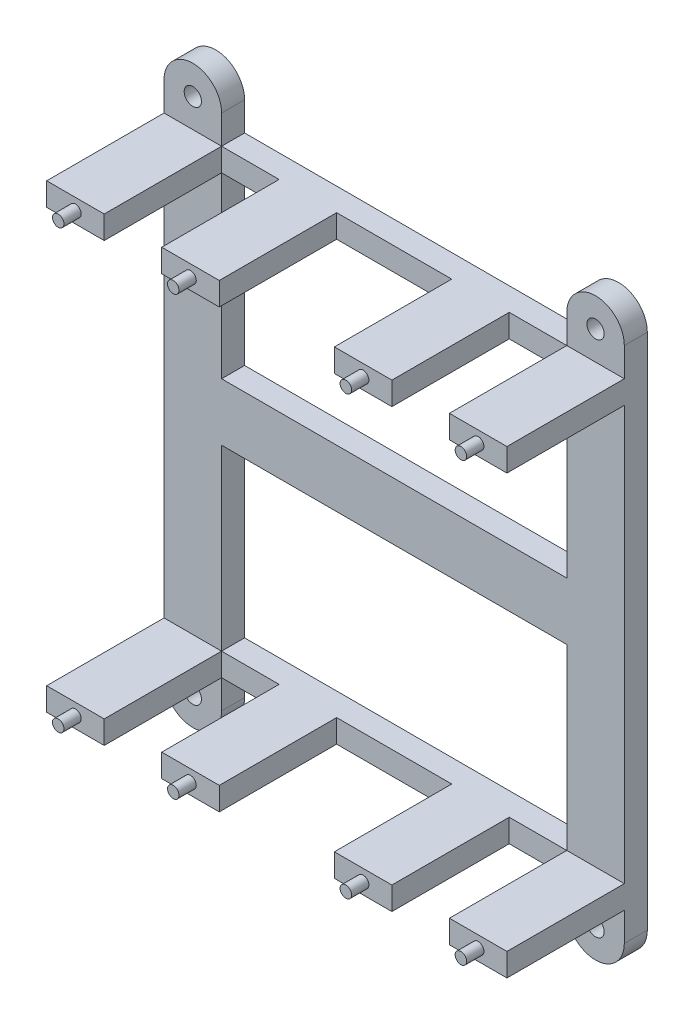
from build123d import *
from build123d.topology import SkipClean

# Parameters (mm, degrees)
CROQUIS1_W                  = 10
CROQUIS1_H                  = 10
CROQUIS1_R                  = 1.5
CROQUIS1_H_2                = 4
CROQUIS1_R_2                = 3
CROQUIS1_R_3                = 1.25
CROQUIS1_R_4                = 3.5
CROQUIS1_R_5                = 2.2
SALIENTE_EXTRUIR5_DEPTH     = 4
SALIENTE_EXTRUIR6_START     = 4
CROQUIS1_6_W                = 10
CROQUIS1_6_H                = 4
SALIENTE_EXTRUIR6_DEPTH     = 20.4
SALIENTE_EXTRUIR7_START     = 24.4
CROQUIS1_7_W                = 10
CROQUIS1_7_H                = 4
CROQUIS1_7_R                = 3
CROQUIS1_7_R_2              = 3.5
CROQUIS1_7_R_3              = 2.2
CROQUIS1_7_R_4              = 1.5
CROQUIS1_7_R_5              = 1.25
CROQUIS1_7_H_2              = 31
CROQUIS1_7_H_3              = 10
SALIENTE_EXTRUIR7_DEPTH     = 4
SALIENTE_EXTRUIR9_START     = 28.4
SALIENTE_EXTRUIR9_OUTLINE_R = 3
SALIENTE_EXTRUIR9_DEPTH     = 4
SALIENTE_EXTRUIR10_START    = 28.4
CROQUIS1_11_R               = 3.5
SALIENTE_EXTRUIR10_DEPTH    = 14
CORTAR_EXTRUIR1_DEPTH       = 14
CORTAR_EXTRUIR1_DEPTH_BACK  = 14
CORTAR_EXTRUIR1_START       = 28.4
CROQUIS1_12_R               = 1.5
CROQUIS1_12_R_2             = 1.25
CORTAR_EXTRUIR2_START       = 24.4
CROQUIS1_13_R               = 2.2
CORTAR_EXTRUIR2_DEPTH       = 15
REDONDEO2_RADIUS            = 5
REDONDEO2_LENGTH            = 4
REDONDEO3_RADIUS            = 5
REDONDEO3_LENGTH            = 4
REDONDEO4_RADIUS            = 5
REDONDEO4_LENGTH            = 4
REDONDEO5_RADIUS            = 5
REDONDEO5_LENGTH            = 4
REDONDEO6_R                 = 4
REDONDEO7_R                 = 4
CORTAR_EXTRUIR6_START       = 28.4
CROQUIS2_RX                 = 30
CROQUIS2_RY                 = 25
CROQUIS2_RX_2               = 36
CROQUIS2_RY_2               = 20
CORTAR_EXTRUIR6_DEPTH       = 8
CROQUIS3_W                  = 80
CROQUIS3_H                  = 18
CORTAR_EXTRUIR7_DEPTH       = 80
CROQUIS4_R                  = 1
SALIENTE_EXTRUIR11_DEPTH    = 3


# Read off the part's stored shape, not the designer's step: Saliente-Extruir9
with BuildPart() as part:
    # Croquis1 → Saliente-Extruir5 (new body)
    # profile 1 of 42: a face of its own
    with SkipClean():  # the faces are left unmerged after this step: merging them gives an invalid solid
        with BuildSketch(Plane.XY):
            with Locations((-45.946521078, 63.070175439)):
                Rectangle(CROQUIS1_W, CROQUIS1_H)
            with Locations((-45.946521078, 63.070175439)):
                Circle(CROQUIS1_R, mode=Mode.SUBTRACT)
        # profile 2 of 42: a face of its own
        with BuildSketch(Plane.XY):
            with Locations((24.053478922, 63.070175439)):
                Rectangle(CROQUIS1_W, CROQUIS1_H)
            with Locations((24.053478922, 63.070175439)):
                Circle(CROQUIS1_R, mode=Mode.SUBTRACT)
        # profile 3 of 42: a face of its own
        with BuildSketch(Plane.XY):
            with Locations((24.053478922, -26.929824561)):
                Rectangle(CROQUIS1_W, CROQUIS1_H)
            with Locations((24.053478922, -26.929824561)):
                Circle(CROQUIS1_R, mode=Mode.SUBTRACT)
        # profile 4 of 42: a face of its own
        with BuildSketch(Plane.XY):
            with Locations((-45.946521078, -26.929824561)):
                Rectangle(CROQUIS1_W, CROQUIS1_H)
            with Locations((-45.946521078, -26.929824561)):
                Circle(CROQUIS1_R, mode=Mode.SUBTRACT)
        # profile 5 of 42: a face of its own
        with BuildSketch(Plane.XY):
            with Locations((-45.946521078, -19.929824561)):
                Rectangle(CROQUIS1_W, CROQUIS1_H_2)
        # profile 6 of 42: a face of its own
        with BuildSketch(Plane.XY):
            with Locations((-35.946521078, -19.929824561)):
                Rectangle(CROQUIS1_W, CROQUIS1_H_2)
        # profile 7 of 42: a face of its own
        with BuildSketch(Plane.XY):
            with Locations((-25.946521078, -19.929824561)):
                Rectangle(CROQUIS1_W, CROQUIS1_H_2)
        # profile 8 of 42: a face of its own
        with BuildSketch(Plane.XY):
            with Locations((-15.946521078, -19.929824561)):
                Rectangle(CROQUIS1_W, CROQUIS1_H_2)
        # profile 9 of 42: a face of its own
        with BuildSketch(Plane.XY):
            with Locations((-5.946521078, -19.929824561)):
                Rectangle(CROQUIS1_W, CROQUIS1_H_2)
        # profile 10 of 42: a face of its own
        with BuildSketch(Plane.XY):
            with Locations((4.053478922, -19.929824561)):
                Rectangle(CROQUIS1_W, CROQUIS1_H_2)
        # profile 11 of 42: a face of its own
        with BuildSketch(Plane.XY):
            with Locations((14.053478922, -19.929824561)):
                Rectangle(CROQUIS1_W, CROQUIS1_H_2)
        # profile 12 of 42: a face of its own
        with BuildSketch(Plane.XY):
            with Locations((24.053478922, -19.929824561)):
                Rectangle(CROQUIS1_W, CROQUIS1_H_2)
        # profile 13 of 42: a face of its own
        with BuildSketch(Plane.XY):
            Polygon((29.053478922, 13.070175439), (19.053478922, 13.070175439), (19.053478922, -17.929824561), (29.053478922, -17.929824561), (29.053478922, -6.429824561), align=None)
            with Locations((26.053478922, -6.429824561)):
                Circle(CROQUIS1_R_2, mode=Mode.SUBTRACT)
        # profile 14 of 42: a face of its own
        with BuildSketch(Plane.XY):
            with Locations((26.053478922, -6.429824561)):
                Circle(CROQUIS1_R_2)
            with Locations((26.053478922, -6.429824561)):
                Circle(CROQUIS1_R_3, mode=Mode.SUBTRACT)
        # profile 15 of 42: a face of its own
        with BuildSketch(Plane.XY):
            with Locations((26.053478922, -6.429824561)):
                Circle(CROQUIS1_R_3)
        # profile 16 of 42: a face of its own
        with BuildSketch(Plane.XY):
            Polygon((-40.946521078, -17.929824561), (-40.946521078, 13.070175439), (-50.946521078, 13.070175439), (-50.946521078, -6.929824541), (-50.946521078, -17.929824561), align=None)
            with BuildLine():
                ThreePointArc((-43.946521078, -6.929824561), (-47.446521088, -10.429824561), (-50.946521078, -6.929824541))
                ThreePointArc((-50.946521078, -6.929824541), (-47.446521067, -3.429824561), (-43.946521078, -6.929824561))
            make_face(mode=Mode.SUBTRACT)
        # profile 17 of 42: a face of its own
        with BuildSketch(Plane.XY):
            with Locations((-47.446521078, -6.929824561)):
                Circle(CROQUIS1_R_4)
            with Locations((-47.446521078, -6.929824561)):
                Circle(CROQUIS1_R_5, mode=Mode.SUBTRACT)
        # profile 18 of 42: a face of its own
        with BuildSketch(Plane.XY):
            with Locations((-47.446521078, -6.929824561)):
                Circle(CROQUIS1_R_5)
            with Locations((-47.446521078, -6.929824561)):
                Circle(CROQUIS1_R, mode=Mode.SUBTRACT)
        # profile 19 of 42: a face of its own
        with BuildSketch(Plane.XY):
            with Locations((-47.446521078, -6.929824561)):
                Circle(CROQUIS1_R)
        # profile 20 of 42: a face of its own
        with BuildSketch(Plane.XY):
            with Locations((-45.946521078, 18.070175439)):
                Rectangle(CROQUIS1_W, CROQUIS1_H)
        # profile 21 of 42: a face of its own
        with BuildSketch(Plane.XY):
            with Locations((-35.946521078, 18.070175439)):
                Rectangle(CROQUIS1_W, CROQUIS1_H)
        # profile 22 of 42: a face of its own
        with BuildSketch(Plane.XY):
            with Locations((-25.946521078, 18.070175439)):
                Rectangle(CROQUIS1_W, CROQUIS1_H)
        # profile 23 of 42: a face of its own
        with BuildSketch(Plane.XY):
            with Locations((-15.946521078, 18.070175439)):
                Rectangle(CROQUIS1_W, CROQUIS1_H)
        # profile 24 of 42: a face of its own
        with BuildSketch(Plane.XY):
            with Locations((-5.946521078, 18.070175439)):
                Rectangle(CROQUIS1_W, CROQUIS1_H)
        # profile 25 of 42: a face of its own
        with BuildSketch(Plane.XY):
            with Locations((4.053478922, 18.070175439)):
                Rectangle(CROQUIS1_W, CROQUIS1_H)
        # profile 26 of 42: a face of its own
        with BuildSketch(Plane.XY):
            with Locations((14.053478922, 18.070175439)):
                Rectangle(CROQUIS1_W, CROQUIS1_H)
        # profile 27 of 42: a face of its own
        with BuildSketch(Plane.XY):
            with Locations((24.053478922, 18.070175439)):
                Rectangle(CROQUIS1_W, CROQUIS1_H)
        # profile 28 of 42: a face of its own
        with BuildSketch(Plane.XY):
            Polygon((-40.946521078, 54.070175439), (-50.946521078, 54.070175439), (-50.946521078, 43.070175439), (-50.946521078, 23.070175439), (-40.946521078, 23.070175439), align=None)
            with BuildLine():
                ThreePointArc((-43.946521078, 43.070175439), (-47.446521078, 39.570175439), (-50.946521078, 43.070175439))
                ThreePointArc((-50.946521078, 43.070175439), (-47.446521078, 46.570175439), (-43.946521078, 43.070175439))
            make_face(mode=Mode.SUBTRACT)
        # profile 29 of 42: a face of its own
        with BuildSketch(Plane.XY):
            with Locations((-45.946521078, 56.070175439)):
                Rectangle(CROQUIS1_W, CROQUIS1_H_2)
        # profile 30 of 42: a face of its own
        with BuildSketch(Plane.XY):
            with Locations((-47.446521078, 43.070175439)):
                Circle(CROQUIS1_R_4)
            with Locations((-47.446521078, 43.070175439)):
                Circle(CROQUIS1_R_5, mode=Mode.SUBTRACT)
        # profile 31 of 42: a face of its own
        with BuildSketch(Plane.XY):
            with Locations((-47.446521078, 43.070175439)):
                Circle(CROQUIS1_R_5)
            with Locations((-47.446521078, 43.070175439)):
                Circle(CROQUIS1_R, mode=Mode.SUBTRACT)
        # profile 32 of 42: a face of its own
        with BuildSketch(Plane.XY):
            with Locations((-47.446521078, 43.070175439)):
                Circle(CROQUIS1_R)
        # profile 33 of 42: a face of its own
        with BuildSketch(Plane.XY):
            with Locations((-35.946521078, 56.070175439)):
                Rectangle(CROQUIS1_W, CROQUIS1_H_2)
        # profile 34 of 42: a face of its own
        with BuildSketch(Plane.XY):
            with Locations((-25.946521078, 56.070175439)):
                Rectangle(CROQUIS1_W, CROQUIS1_H_2)
        # profile 35 of 42: a face of its own
        with BuildSketch(Plane.XY):
            with Locations((-15.946521078, 56.070175439)):
                Rectangle(CROQUIS1_W, CROQUIS1_H_2)
        # profile 36 of 42: a face of its own
        with BuildSketch(Plane.XY):
            with Locations((-5.946521078, 56.070175439)):
                Rectangle(CROQUIS1_W, CROQUIS1_H_2)
        # profile 37 of 42: a face of its own
        with BuildSketch(Plane.XY):
            with Locations((4.053478922, 56.070175439)):
                Rectangle(CROQUIS1_W, CROQUIS1_H_2)
        # profile 38 of 42: a face of its own
        with BuildSketch(Plane.XY):
            with Locations((14.053478922, 56.070175439)):
                Rectangle(CROQUIS1_W, CROQUIS1_H_2)
        # profile 39 of 42: a face of its own
        with BuildSketch(Plane.XY):
            with Locations((24.053478922, 56.070175439)):
                Rectangle(CROQUIS1_W, CROQUIS1_H_2)
        # profile 40 of 42: a face of its own
        with BuildSketch(Plane.XY):
            Polygon((29.053478922, 54.070175439), (19.053478922, 54.070175439), (19.053478922, 23.070175439), (29.053478922, 23.070175439), (29.053478922, 42.570175439), align=None)
            with Locations((26.053478922, 42.570175439)):
                Circle(CROQUIS1_R_2, mode=Mode.SUBTRACT)
        # profile 41 of 42: a face of its own
        with BuildSketch(Plane.XY):
            with Locations((26.053478922, 42.570175439)):
                Circle(CROQUIS1_R_2)
            with Locations((26.053478922, 42.570175439)):
                Circle(CROQUIS1_R_3, mode=Mode.SUBTRACT)
        # profile 42 of 42: a face of its own
        with BuildSketch(Plane.XY):
            with Locations((26.053478922, 42.570175439)):
                Circle(CROQUIS1_R_3)
        extrude(amount=SALIENTE_EXTRUIR5_DEPTH)

    # Croquis1<6> → Saliente-Extruir6 (add)
    with BuildSketch(Plane.XY.offset(SALIENTE_EXTRUIR6_START)):
        with Locations((-45.946521078, 56.070175439)):
            Rectangle(CROQUIS1_6_W, CROQUIS1_6_H)
        with Locations((-25.946521078, 56.070175439)):
            Rectangle(CROQUIS1_6_W, CROQUIS1_6_H)
        with Locations((24.053478922, 56.070175439)):
            Rectangle(CROQUIS1_6_W, CROQUIS1_6_H)
        with Locations((4.053478922, 56.070175439)):
            Rectangle(CROQUIS1_6_W, CROQUIS1_6_H)
        with Locations((-45.946521078, -19.929824561)):
            Rectangle(CROQUIS1_6_W, CROQUIS1_6_H)
        with Locations((-25.946521078, -19.929824561)):
            Rectangle(CROQUIS1_6_W, CROQUIS1_6_H)
        with Locations((4.053478922, -19.929824561)):
            Rectangle(CROQUIS1_6_W, CROQUIS1_6_H)
        with Locations((24.053478922, -19.929824561)):
            Rectangle(CROQUIS1_6_W, CROQUIS1_6_H)
    extrude(amount=SALIENTE_EXTRUIR6_DEPTH)

    # Croquis1<7> → Saliente-Extruir7 (add)
    # profile 1 of 90: a face of its own
    with SkipClean():  # the faces are left unmerged after this step: merging them gives an invalid solid
        with BuildSketch(Plane.XY.offset(SALIENTE_EXTRUIR7_START)):
            with Locations((-45.946521078, 56.070175439)):
                Rectangle(CROQUIS1_7_W, CROQUIS1_7_H)
        # profile 2 of 90: a face of its own
        with BuildSketch(Plane.XY.offset(SALIENTE_EXTRUIR7_START)):
            with Locations((-35.946521078, 56.070175439)):
                Rectangle(CROQUIS1_7_W, CROQUIS1_7_H)
        # profile 3 of 90: a face of its own
        with BuildSketch(Plane.XY.offset(SALIENTE_EXTRUIR7_START)):
            with Locations((-15.946521078, 56.070175439)):
                Rectangle(CROQUIS1_7_W, CROQUIS1_7_H)
        # profile 4 of 90: a face of its own
        with BuildSketch(Plane.XY.offset(SALIENTE_EXTRUIR7_START)):
            with Locations((-5.946521078, 56.070175439)):
                Rectangle(CROQUIS1_7_W, CROQUIS1_7_H)
        # profile 5 of 90: a face of its own
        with BuildSketch(Plane.XY.offset(SALIENTE_EXTRUIR7_START)):
            with Locations((4.053478922, 56.070175439)):
                Rectangle(CROQUIS1_7_W, CROQUIS1_7_H)
        # profile 6 of 90: a face of its own
        with BuildSketch(Plane.XY.offset(SALIENTE_EXTRUIR7_START)):
            with Locations((-25.946521078, 56.070175439)):
                Rectangle(CROQUIS1_7_W, CROQUIS1_7_H)
        # profile 7 of 90: a face of its own
        with BuildSketch(Plane.XY.offset(SALIENTE_EXTRUIR7_START)):
            with Locations((14.053478922, 56.070175439)):
                Rectangle(CROQUIS1_7_W, CROQUIS1_7_H)
        # profile 8 of 90: a face of its own
        with BuildSketch(Plane.XY.offset(SALIENTE_EXTRUIR7_START)):
            Polygon((29.053478922, 54.070175439), (19.053478922, 54.070175439), (19.053478922, 23.070175439), (29.053478922, 23.070175439), (29.053478922, 42.570175439), align=None)
            with Locations((26.053478922, 42.570175439)):
                Circle(CROQUIS1_7_R, mode=Mode.SUBTRACT)
        # profile 9 of 90: a face of its own
        with BuildSketch(Plane.XY.offset(SALIENTE_EXTRUIR7_START)):
            Polygon((-40.946521078, 54.070175439), (-50.946521078, 54.070175439), (-50.946521078, 43.070175439), (-50.946521078, 23.070175439), (-40.946521078, 23.070175439), align=None)
            with BuildLine():
                ThreePointArc((-43.946521078, 43.070175439), (-47.446521078, 39.570175439), (-50.946521078, 43.070175439))
                ThreePointArc((-50.946521078, 43.070175439), (-47.446521078, 46.570175439), (-43.946521078, 43.070175439))
            make_face(mode=Mode.SUBTRACT)
        # profile 10 of 90: a face of its own
        with BuildSketch(Plane.XY.offset(SALIENTE_EXTRUIR7_START)):
            with BuildLine():
                Line((-30.946521078, 54.070175439), (-40.946521078, 54.070175439))
                Line((-40.946521078, 54.070175439), (-40.946521078, 23.070175439))
                Line((-40.946521078, 23.070175439), (-30.946521078, 23.070175439))
                Line((-30.946521078, 23.070175439), (-30.946521078, 39.741748314))
                ThreePointArc((-30.946521078, 39.741748314), (-34.946521078, 42.570175439), (-30.946521078, 45.398602563))
                Line((-30.946521078, 45.398602563), (-30.946521078, 54.070175439))
            make_face()
        # profile 11 of 90: a face of its own
        with BuildSketch(Plane.XY.offset(SALIENTE_EXTRUIR7_START)):
            with Locations((-47.446521078, 43.070175439)):
                Circle(CROQUIS1_7_R_2)
            with Locations((-47.446521078, 43.070175439)):
                Circle(CROQUIS1_7_R_3, mode=Mode.SUBTRACT)
        # profile 12 of 90: a face of its own
        with BuildSketch(Plane.XY.offset(SALIENTE_EXTRUIR7_START)):
            with Locations((-47.446521078, 43.070175439)):
                Circle(CROQUIS1_7_R_3)
            with Locations((-47.446521078, 43.070175439)):
                Circle(CROQUIS1_7_R_4, mode=Mode.SUBTRACT)
        # profile 13 of 90: a face of its own
        with BuildSketch(Plane.XY.offset(SALIENTE_EXTRUIR7_START)):
            with Locations((-47.446521078, 43.070175439)):
                Circle(CROQUIS1_7_R_4)
        # profile 14 of 90: a face of its own
        with BuildSketch(Plane.XY.offset(SALIENTE_EXTRUIR7_START)):
            with Locations((26.053478922, 42.570175439)):
                Circle(CROQUIS1_7_R)
            with Locations((26.053478922, 42.570175439)):
                Circle(CROQUIS1_7_R_5, mode=Mode.SUBTRACT)
        # profile 15 of 90: a face of its own
        with BuildSketch(Plane.XY.offset(SALIENTE_EXTRUIR7_START)):
            with Locations((26.053478922, 42.570175439)):
                Circle(CROQUIS1_7_R_5)
        # profile 16 of 90: a face of its own
        with BuildSketch(Plane.XY.offset(SALIENTE_EXTRUIR7_START)):
            with Locations((24.053478922, 56.070175439)):
                Rectangle(CROQUIS1_7_W, CROQUIS1_7_H)
        # profile 17 of 90: a face of its own
        with BuildSketch(Plane.XY.offset(SALIENTE_EXTRUIR7_START)):
            with BuildLine():
                ThreePointArc((-28.946521078, 42.570175439), (-29.497031335, 44.302226246), (-30.946521078, 45.398602563))
                Line((-30.946521078, 45.398602563), (-30.946521078, 43.320175439))
                ThreePointArc((-30.946521078, 43.320175439), (-30.760666955, 42.965460146), (-30.696521078, 42.570175439))
                ThreePointArc((-30.696521078, 42.570175439), (-30.760666955, 42.174890731), (-30.946521078, 41.820175439))
                Line((-30.946521078, 41.820175439), (-30.946521078, 39.741748314))
                ThreePointArc((-30.946521078, 39.741748314), (-29.497031335, 40.838124631), (-28.946521078, 42.570175439))
            make_face()
        # profile 18 of 90: a face of its own
        with BuildSketch(Plane.XY.offset(SALIENTE_EXTRUIR7_START)):
            with BuildLine():
                Line((-30.946521078, 43.320175439), (-30.946521078, 45.398602563))
                ThreePointArc((-30.946521078, 45.398602563), (-34.946521078, 42.570175439), (-30.946521078, 39.741748314))
                Line((-30.946521078, 39.741748314), (-30.946521078, 41.820175439))
                ThreePointArc((-30.946521078, 41.820175439), (-33.196521078, 42.570175439), (-30.946521078, 43.320175439))
            make_face()
        # profile 19 of 90: a face of its own
        with BuildSketch(Plane.XY.offset(SALIENTE_EXTRUIR7_START)):
            with BuildLine():
                ThreePointArc((-30.696521078, 42.570175439), (-30.760666955, 42.965460146), (-30.946521078, 43.320175439))
                Line((-30.946521078, 43.320175439), (-30.946521078, 41.820175439))
                ThreePointArc((-30.946521078, 41.820175439), (-30.760666955, 42.174890731), (-30.696521078, 42.570175439))
            make_face()
        # profile 20 of 90: a face of its own
        with BuildSketch(Plane.XY.offset(SALIENTE_EXTRUIR7_START)):
            with BuildLine():
                Line((-30.946521078, 41.820175439), (-30.946521078, 43.320175439))
                ThreePointArc((-30.946521078, 43.320175439), (-33.196521078, 42.570175439), (-30.946521078, 41.820175439))
            make_face()
        # profile 21 of 90: a face of its own
        with BuildSketch(Plane.XY.offset(SALIENTE_EXTRUIR7_START)):
            with BuildLine():
                ThreePointArc((-28.946521078, 42.570175439), (-29.497031335, 44.302226246), (-30.946521078, 45.398602563))
                Line((-30.946521078, 45.398602563), (-30.946521078, 43.320175439))
                ThreePointArc((-30.946521078, 43.320175439), (-30.760666955, 42.965460146), (-30.696521078, 42.570175439))
                ThreePointArc((-30.696521078, 42.570175439), (-30.760666955, 42.174890731), (-30.946521078, 41.820175439))
                Line((-30.946521078, 41.820175439), (-30.946521078, 39.741748314))
                ThreePointArc((-30.946521078, 39.741748314), (-29.497031335, 40.838124631), (-28.946521078, 42.570175439))
            make_face()
        # profile 22 of 90: a face of its own
        with BuildSketch(Plane.XY.offset(SALIENTE_EXTRUIR7_START)):
            with BuildLine():
                Line((-30.946521078, 43.320175439), (-30.946521078, 45.398602563))
                ThreePointArc((-30.946521078, 45.398602563), (-34.946521078, 42.570175439), (-30.946521078, 39.741748314))
                Line((-30.946521078, 39.741748314), (-30.946521078, 41.820175439))
                ThreePointArc((-30.946521078, 41.820175439), (-33.196521078, 42.570175439), (-30.946521078, 43.320175439))
            make_face()
        # profile 23 of 90: a face of its own
        with BuildSketch(Plane.XY.offset(SALIENTE_EXTRUIR7_START)):
            with BuildLine():
                ThreePointArc((-30.696521078, 42.570175439), (-30.760666955, 42.965460146), (-30.946521078, 43.320175439))
                Line((-30.946521078, 43.320175439), (-30.946521078, 41.820175439))
                ThreePointArc((-30.946521078, 41.820175439), (-30.760666955, 42.174890731), (-30.696521078, 42.570175439))
            make_face()
        # profile 24 of 90: a face of its own
        with BuildSketch(Plane.XY.offset(SALIENTE_EXTRUIR7_START)):
            with BuildLine():
                Line((-30.946521078, 41.820175439), (-30.946521078, 43.320175439))
                ThreePointArc((-30.946521078, 43.320175439), (-33.196521078, 42.570175439), (-30.946521078, 41.820175439))
            make_face()
        # profile 25 of 90: a face of its own
        with BuildSketch(Plane.XY.offset(SALIENTE_EXTRUIR7_START)):
            with BuildLine():
                Line((-20.946521078, 54.070175439), (-30.946521078, 54.070175439))
                Line((-30.946521078, 54.070175439), (-30.946521078, 45.398602563))
                ThreePointArc((-30.946521078, 45.398602563), (-29.497031335, 44.302226246), (-28.946521078, 42.570175439))
                ThreePointArc((-28.946521078, 42.570175439), (-29.497031335, 40.838124631), (-30.946521078, 39.741748314))
                Line((-30.946521078, 39.741748314), (-30.946521078, 23.070175439))
                Line((-30.946521078, 23.070175439), (-20.946521078, 23.070175439))
                Line((-20.946521078, 23.070175439), (-20.946521078, 54.070175439))
            make_face()
        # profile 26 of 90: a face of its own
        with BuildSketch(Plane.XY.offset(SALIENTE_EXTRUIR7_START)):
            with Locations((-15.946521078, 38.570175439)):
                Rectangle(CROQUIS1_7_W, CROQUIS1_7_H_2)
        # profile 27 of 90: a face of its own
        with BuildSketch(Plane.XY.offset(SALIENTE_EXTRUIR7_START)):
            with Locations((-5.946521078, 38.570175439)):
                Rectangle(CROQUIS1_7_W, CROQUIS1_7_H_2)
        # profile 28 of 90: a face of its own
        with BuildSketch(Plane.XY.offset(SALIENTE_EXTRUIR7_START)):
            with BuildLine():
                Line((9.053478922, 54.070175439), (-0.946521078, 54.070175439))
                Line((-0.946521078, 54.070175439), (-0.946521078, 23.070175439))
                Line((-0.946521078, 23.070175439), (9.053478922, 23.070175439))
                Line((9.053478922, 23.070175439), (9.053478922, 45.606073823))
                ThreePointArc((9.053478922, 45.606073823), (6.053478922, 49.070175439), (9.053478922, 52.534277054))
                Line((9.053478922, 52.534277054), (9.053478922, 54.070175439))
            make_face()
        # profile 29 of 90: a face of its own
        with BuildSketch(Plane.XY.offset(SALIENTE_EXTRUIR7_START)):
            with BuildLine():
                ThreePointArc((13.053478922, 49.070175439), (11.84476677, 51.71592675), (9.053478922, 52.534277054))
                Line((9.053478922, 52.534277054), (9.053478922, 51.212603967))
                ThreePointArc((9.053478922, 51.212603967), (10.920958355, 50.793544233), (11.753478922, 49.070175439))
                ThreePointArc((11.753478922, 49.070175439), (10.920958355, 47.346806645), (9.053478922, 46.92774691))
                Line((9.053478922, 46.92774691), (9.053478922, 45.606073823))
                ThreePointArc((9.053478922, 45.606073823), (11.84476677, 46.424424128), (13.053478922, 49.070175439))
            make_face()
        # profile 30 of 90: a face of its own
        with BuildSketch(Plane.XY.offset(SALIENTE_EXTRUIR7_START)):
            with BuildLine():
                Line((9.053478922, 51.212603967), (9.053478922, 52.534277054))
                ThreePointArc((9.053478922, 52.534277054), (6.053478922, 49.070175439), (9.053478922, 45.606073823))
                Line((9.053478922, 45.606073823), (9.053478922, 46.92774691))
                ThreePointArc((9.053478922, 46.92774691), (7.353478922, 49.070175439), (9.053478922, 51.212603967))
            make_face()
        # profile 31 of 90: a face of its own
        with BuildSketch(Plane.XY.offset(SALIENTE_EXTRUIR7_START)):
            with BuildLine():
                ThreePointArc((11.753478922, 49.070175439), (10.920958355, 50.793544233), (9.053478922, 51.212603967))
                Line((9.053478922, 51.212603967), (9.053478922, 50.484389001))
                ThreePointArc((9.053478922, 50.484389001), (10.419504326, 50.29492031), (11.053478922, 49.070175439))
                ThreePointArc((11.053478922, 49.070175439), (10.419504326, 47.845430567), (9.053478922, 47.655961876))
                Line((9.053478922, 47.655961876), (9.053478922, 46.92774691))
                ThreePointArc((9.053478922, 46.92774691), (10.920958355, 47.346806645), (11.753478922, 49.070175439))
            make_face()
        # profile 32 of 90: a face of its own
        with BuildSketch(Plane.XY.offset(SALIENTE_EXTRUIR7_START)):
            with BuildLine():
                Line((9.053478922, 50.484389001), (9.053478922, 51.212603967))
                ThreePointArc((9.053478922, 51.212603967), (7.353478922, 49.070175439), (9.053478922, 46.92774691))
                Line((9.053478922, 46.92774691), (9.053478922, 47.655961876))
                ThreePointArc((9.053478922, 47.655961876), (8.053478922, 49.070175439), (9.053478922, 50.484389001))
            make_face()
        # profile 33 of 90: a face of its own
        with BuildSketch(Plane.XY.offset(SALIENTE_EXTRUIR7_START)):
            with BuildLine():
                ThreePointArc((11.053478922, 49.070175439), (10.419504326, 50.29492031), (9.053478922, 50.484389001))
                Line((9.053478922, 50.484389001), (9.053478922, 47.655961876))
                ThreePointArc((9.053478922, 47.655961876), (10.419504326, 47.845430567), (11.053478922, 49.070175439))
            make_face()
        # profile 34 of 90: a face of its own
        with BuildSketch(Plane.XY.offset(SALIENTE_EXTRUIR7_START)):
            with BuildLine():
                Line((9.053478922, 47.655961876), (9.053478922, 50.484389001))
                ThreePointArc((9.053478922, 50.484389001), (8.053478922, 49.070175439), (9.053478922, 47.655961876))
            make_face()
        # profile 35 of 90: a face of its own
        with BuildSketch(Plane.XY.offset(SALIENTE_EXTRUIR7_START)):
            with BuildLine():
                ThreePointArc((11.053478922, 49.070175439), (10.419504326, 50.29492031), (9.053478922, 50.484389001))
                Line((9.053478922, 50.484389001), (9.053478922, 47.655961876))
                ThreePointArc((9.053478922, 47.655961876), (10.419504326, 47.845430567), (11.053478922, 49.070175439))
            make_face()
        # profile 36 of 90: a face of its own
        with BuildSketch(Plane.XY.offset(SALIENTE_EXTRUIR7_START)):
            with BuildLine():
                Line((9.053478922, 47.655961876), (9.053478922, 50.484389001))
                ThreePointArc((9.053478922, 50.484389001), (8.053478922, 49.070175439), (9.053478922, 47.655961876))
            make_face()
        # profile 37 of 90: a face of its own
        with BuildSketch(Plane.XY.offset(SALIENTE_EXTRUIR7_START)):
            with BuildLine():
                ThreePointArc((11.753478922, 49.070175439), (10.920958355, 50.793544233), (9.053478922, 51.212603967))
                Line((9.053478922, 51.212603967), (9.053478922, 50.484389001))
                ThreePointArc((9.053478922, 50.484389001), (10.419504326, 50.29492031), (11.053478922, 49.070175439))
                ThreePointArc((11.053478922, 49.070175439), (10.419504326, 47.845430567), (9.053478922, 47.655961876))
                Line((9.053478922, 47.655961876), (9.053478922, 46.92774691))
                ThreePointArc((9.053478922, 46.92774691), (10.920958355, 47.346806645), (11.753478922, 49.070175439))
            make_face()
        # profile 38 of 90: a face of its own
        with BuildSketch(Plane.XY.offset(SALIENTE_EXTRUIR7_START)):
            with BuildLine():
                Line((9.053478922, 50.484389001), (9.053478922, 51.212603967))
                ThreePointArc((9.053478922, 51.212603967), (7.353478922, 49.070175439), (9.053478922, 46.92774691))
                Line((9.053478922, 46.92774691), (9.053478922, 47.655961876))
                ThreePointArc((9.053478922, 47.655961876), (8.053478922, 49.070175439), (9.053478922, 50.484389001))
            make_face()
        # profile 39 of 90: a face of its own
        with BuildSketch(Plane.XY.offset(SALIENTE_EXTRUIR7_START)):
            with BuildLine():
                ThreePointArc((13.053478922, 49.070175439), (11.84476677, 51.71592675), (9.053478922, 52.534277054))
                Line((9.053478922, 52.534277054), (9.053478922, 51.212603967))
                ThreePointArc((9.053478922, 51.212603967), (10.920958355, 50.793544233), (11.753478922, 49.070175439))
                ThreePointArc((11.753478922, 49.070175439), (10.920958355, 47.346806645), (9.053478922, 46.92774691))
                Line((9.053478922, 46.92774691), (9.053478922, 45.606073823))
                ThreePointArc((9.053478922, 45.606073823), (11.84476677, 46.424424128), (13.053478922, 49.070175439))
            make_face()
        # profile 40 of 90: a face of its own
        with BuildSketch(Plane.XY.offset(SALIENTE_EXTRUIR7_START)):
            with BuildLine():
                Line((9.053478922, 51.212603967), (9.053478922, 52.534277054))
                ThreePointArc((9.053478922, 52.534277054), (6.053478922, 49.070175439), (9.053478922, 45.606073823))
                Line((9.053478922, 45.606073823), (9.053478922, 46.92774691))
                ThreePointArc((9.053478922, 46.92774691), (7.353478922, 49.070175439), (9.053478922, 51.212603967))
            make_face()
        # profile 41 of 90: a face of its own
        with BuildSketch(Plane.XY.offset(SALIENTE_EXTRUIR7_START)):
            with BuildLine():
                Line((19.053478922, 54.070175439), (9.053478922, 54.070175439))
                Line((9.053478922, 54.070175439), (9.053478922, 52.534277054))
                ThreePointArc((9.053478922, 52.534277054), (11.84476677, 51.71592675), (13.053478922, 49.070175439))
                ThreePointArc((13.053478922, 49.070175439), (11.84476677, 46.424424128), (9.053478922, 45.606073823))
                Line((9.053478922, 45.606073823), (9.053478922, 23.070175439))
                Line((9.053478922, 23.070175439), (19.053478922, 23.070175439))
                Line((19.053478922, 23.070175439), (19.053478922, 54.070175439))
            make_face()
        # profile 42 of 90: a face of its own
        with BuildSketch(Plane.XY.offset(SALIENTE_EXTRUIR7_START)):
            with Locations((24.053478922, 18.070175439)):
                Rectangle(CROQUIS1_7_W, CROQUIS1_7_H_3)
        # profile 43 of 90: a face of its own
        with BuildSketch(Plane.XY.offset(SALIENTE_EXTRUIR7_START)):
            with Locations((14.053478922, 18.070175439)):
                Rectangle(CROQUIS1_7_W, CROQUIS1_7_H_3)
        # profile 44 of 90: a face of its own
        with BuildSketch(Plane.XY.offset(SALIENTE_EXTRUIR7_START)):
            with Locations((4.053478922, 18.070175439)):
                Rectangle(CROQUIS1_7_W, CROQUIS1_7_H_3)
        # profile 45 of 90: a face of its own
        with BuildSketch(Plane.XY.offset(SALIENTE_EXTRUIR7_START)):
            with Locations((-5.946521078, 18.070175439)):
                Rectangle(CROQUIS1_7_W, CROQUIS1_7_H_3)
        # profile 46 of 90: a face of its own
        with BuildSketch(Plane.XY.offset(SALIENTE_EXTRUIR7_START)):
            with Locations((-15.946521078, 18.070175439)):
                Rectangle(CROQUIS1_7_W, CROQUIS1_7_H_3)
        # profile 47 of 90: a face of its own
        with BuildSketch(Plane.XY.offset(SALIENTE_EXTRUIR7_START)):
            with Locations((-25.946521078, 18.070175439)):
                Rectangle(CROQUIS1_7_W, CROQUIS1_7_H_3)
        # profile 48 of 90: a face of its own
        with BuildSketch(Plane.XY.offset(SALIENTE_EXTRUIR7_START)):
            with Locations((-35.946521078, 18.070175439)):
                Rectangle(CROQUIS1_7_W, CROQUIS1_7_H_3)
        # profile 49 of 90: a face of its own
        with BuildSketch(Plane.XY.offset(SALIENTE_EXTRUIR7_START)):
            with Locations((-45.946521078, 18.070175439)):
                Rectangle(CROQUIS1_7_W, CROQUIS1_7_H_3)
        # profile 50 of 90: a face of its own
        with BuildSketch(Plane.XY.offset(SALIENTE_EXTRUIR7_START)):
            with BuildLine():
                Line((-30.946521078, 13.070175439), (-40.946521078, 13.070175439))
                Line((-40.946521078, 13.070175439), (-40.946521078, -17.929824561))
                Line((-40.946521078, -17.929824561), (-30.946521078, -17.929824561))
                Line((-30.946521078, -17.929824561), (-30.946521078, -9.258251686))
                ThreePointArc((-30.946521078, -9.258251686), (-34.946521078, -6.429824561), (-30.946521078, -3.601397437))
                Line((-30.946521078, -3.601397437), (-30.946521078, 13.070175439))
            make_face()
        # profile 51 of 90: a face of its own
        with BuildSketch(Plane.XY.offset(SALIENTE_EXTRUIR7_START)):
            with BuildLine():
                Line((-20.946521078, 13.070175439), (-30.946521078, 13.070175439))
                Line((-30.946521078, 13.070175439), (-30.946521078, -3.601397437))
                ThreePointArc((-30.946521078, -3.601397437), (-29.497031335, -4.697773754), (-28.946521078, -6.429824561))
                ThreePointArc((-28.946521078, -6.429824561), (-29.497031335, -8.161875369), (-30.946521078, -9.258251686))
                Line((-30.946521078, -9.258251686), (-30.946521078, -17.929824561))
                Line((-30.946521078, -17.929824561), (-20.946521078, -17.929824561))
                Line((-20.946521078, -17.929824561), (-20.946521078, 13.070175439))
            make_face()
        # profile 52 of 90: a face of its own
        with BuildSketch(Plane.XY.offset(SALIENTE_EXTRUIR7_START)):
            with Locations((-15.946521078, -2.429824561)):
                Rectangle(CROQUIS1_7_W, CROQUIS1_7_H_2)
        # profile 53 of 90: a face of its own
        with BuildSketch(Plane.XY.offset(SALIENTE_EXTRUIR7_START)):
            with Locations((-5.946521078, -2.429824561)):
                Rectangle(CROQUIS1_7_W, CROQUIS1_7_H_2)
        # profile 54 of 90: a face of its own
        with BuildSketch(Plane.XY.offset(SALIENTE_EXTRUIR7_START)):
            with BuildLine():
                Line((9.053478922, 13.070175439), (-0.946521078, 13.070175439))
                Line((-0.946521078, 13.070175439), (-0.946521078, -17.929824561))
                Line((-0.946521078, -17.929824561), (9.053478922, -17.929824561))
                Line((9.053478922, -17.929824561), (9.053478922, -16.393926177))
                ThreePointArc((9.053478922, -16.393926177), (6.053478922, -12.929824561), (9.053478922, -9.465722946))
                Line((9.053478922, -9.465722946), (9.053478922, 13.070175439))
            make_face()
        # profile 55 of 90: a face of its own
        with BuildSketch(Plane.XY.offset(SALIENTE_EXTRUIR7_START)):
            with BuildLine():
                Line((19.053478922, 13.070175439), (9.053478922, 13.070175439))
                Line((9.053478922, 13.070175439), (9.053478922, -9.465722946))
                ThreePointArc((9.053478922, -9.465722946), (11.84476677, -10.28407325), (13.053478922, -12.929824561))
                ThreePointArc((13.053478922, -12.929824561), (11.84476677, -15.575575872), (9.053478922, -16.393926177))
                Line((9.053478922, -16.393926177), (9.053478922, -17.929824561))
                Line((9.053478922, -17.929824561), (19.053478922, -17.929824561))
                Line((19.053478922, -17.929824561), (19.053478922, 13.070175439))
            make_face()
        # profile 56 of 90: a face of its own
        with BuildSketch(Plane.XY.offset(SALIENTE_EXTRUIR7_START)):
            Polygon((-40.946521078, -17.929824561), (-40.946521078, 13.070175439), (-50.946521078, 13.070175439), (-50.946521078, -6.929824541), (-50.946521078, -17.929824561), align=None)
            with BuildLine():
                ThreePointArc((-43.946521078, -6.929824561), (-47.446521088, -10.429824561), (-50.946521078, -6.929824541))
                ThreePointArc((-50.946521078, -6.929824541), (-47.446521067, -3.429824561), (-43.946521078, -6.929824561))
            make_face(mode=Mode.SUBTRACT)
        # profile 57 of 90: a face of its own
        with BuildSketch(Plane.XY.offset(SALIENTE_EXTRUIR7_START)):
            with Locations((-47.446521078, -6.929824561)):
                Circle(CROQUIS1_7_R_2)
            with Locations((-47.446521078, -6.929824561)):
                Circle(CROQUIS1_7_R_3, mode=Mode.SUBTRACT)
        # profile 58 of 90: a face of its own
        with BuildSketch(Plane.XY.offset(SALIENTE_EXTRUIR7_START)):
            with Locations((-47.446521078, -6.929824561)):
                Circle(CROQUIS1_7_R_3)
            with Locations((-47.446521078, -6.929824561)):
                Circle(CROQUIS1_7_R_4, mode=Mode.SUBTRACT)
        # profile 59 of 90: a face of its own
        with BuildSketch(Plane.XY.offset(SALIENTE_EXTRUIR7_START)):
            with Locations((-47.446521078, -6.929824561)):
                Circle(CROQUIS1_7_R_4)
        # profile 60 of 90: a face of its own
        with BuildSketch(Plane.XY.offset(SALIENTE_EXTRUIR7_START)):
            with BuildLine():
                ThreePointArc((-28.946521078, -6.429824561), (-29.497031335, -4.697773754), (-30.946521078, -3.601397437))
                Line((-30.946521078, -3.601397437), (-30.946521078, -5.679824561))
                ThreePointArc((-30.946521078, -5.679824561), (-30.760666955, -6.034539854), (-30.696521078, -6.429824561))
                ThreePointArc((-30.696521078, -6.429824561), (-30.760666955, -6.825109269), (-30.946521078, -7.179824561))
                Line((-30.946521078, -7.179824561), (-30.946521078, -9.258251686))
                ThreePointArc((-30.946521078, -9.258251686), (-29.497031335, -8.161875369), (-28.946521078, -6.429824561))
            make_face()
        # profile 61 of 90: a face of its own
        with BuildSketch(Plane.XY.offset(SALIENTE_EXTRUIR7_START)):
            with BuildLine():
                Line((-30.946521078, -5.679824561), (-30.946521078, -3.601397437))
                ThreePointArc((-30.946521078, -3.601397437), (-34.946521078, -6.429824561), (-30.946521078, -9.258251686))
                Line((-30.946521078, -9.258251686), (-30.946521078, -7.179824561))
                ThreePointArc((-30.946521078, -7.179824561), (-33.196521078, -6.429824561), (-30.946521078, -5.679824561))
            make_face()
        # profile 62 of 90: a face of its own
        with BuildSketch(Plane.XY.offset(SALIENTE_EXTRUIR7_START)):
            with BuildLine():
                ThreePointArc((-30.696521078, -6.429824561), (-30.760666955, -6.034539854), (-30.946521078, -5.679824561))
                Line((-30.946521078, -5.679824561), (-30.946521078, -7.179824561))
                ThreePointArc((-30.946521078, -7.179824561), (-30.760666955, -6.825109269), (-30.696521078, -6.429824561))
            make_face()
        # profile 63 of 90: a face of its own
        with BuildSketch(Plane.XY.offset(SALIENTE_EXTRUIR7_START)):
            with BuildLine():
                Line((-30.946521078, -7.179824561), (-30.946521078, -5.679824561))
                ThreePointArc((-30.946521078, -5.679824561), (-33.196521078, -6.429824561), (-30.946521078, -7.179824561))
            make_face()
        # profile 64 of 90: a face of its own
        with BuildSketch(Plane.XY.offset(SALIENTE_EXTRUIR7_START)):
            with BuildLine():
                ThreePointArc((-30.696521078, -6.429824561), (-30.760666955, -6.034539854), (-30.946521078, -5.679824561))
                Line((-30.946521078, -5.679824561), (-30.946521078, -7.179824561))
                ThreePointArc((-30.946521078, -7.179824561), (-30.760666955, -6.825109269), (-30.696521078, -6.429824561))
            make_face()
        # profile 65 of 90: a face of its own
        with BuildSketch(Plane.XY.offset(SALIENTE_EXTRUIR7_START)):
            with BuildLine():
                Line((-30.946521078, -7.179824561), (-30.946521078, -5.679824561))
                ThreePointArc((-30.946521078, -5.679824561), (-33.196521078, -6.429824561), (-30.946521078, -7.179824561))
            make_face()
        # profile 66 of 90: a face of its own
        with BuildSketch(Plane.XY.offset(SALIENTE_EXTRUIR7_START)):
            with BuildLine():
                ThreePointArc((-28.946521078, -6.429824561), (-29.497031335, -4.697773754), (-30.946521078, -3.601397437))
                Line((-30.946521078, -3.601397437), (-30.946521078, -5.679824561))
                ThreePointArc((-30.946521078, -5.679824561), (-30.760666955, -6.034539854), (-30.696521078, -6.429824561))
                ThreePointArc((-30.696521078, -6.429824561), (-30.760666955, -6.825109269), (-30.946521078, -7.179824561))
                Line((-30.946521078, -7.179824561), (-30.946521078, -9.258251686))
                ThreePointArc((-30.946521078, -9.258251686), (-29.497031335, -8.161875369), (-28.946521078, -6.429824561))
            make_face()
        # profile 67 of 90: a face of its own
        with BuildSketch(Plane.XY.offset(SALIENTE_EXTRUIR7_START)):
            with BuildLine():
                Line((-30.946521078, -5.679824561), (-30.946521078, -3.601397437))
                ThreePointArc((-30.946521078, -3.601397437), (-34.946521078, -6.429824561), (-30.946521078, -9.258251686))
                Line((-30.946521078, -9.258251686), (-30.946521078, -7.179824561))
                ThreePointArc((-30.946521078, -7.179824561), (-33.196521078, -6.429824561), (-30.946521078, -5.679824561))
            make_face()
        # profile 68 of 90: a face of its own
        with BuildSketch(Plane.XY.offset(SALIENTE_EXTRUIR7_START)):
            with BuildLine():
                ThreePointArc((11.053478922, -12.929824561), (10.419504326, -11.70507969), (9.053478922, -11.515610999))
                Line((9.053478922, -11.515610999), (9.053478922, -14.344038124))
                ThreePointArc((9.053478922, -14.344038124), (10.419504326, -14.154569433), (11.053478922, -12.929824561))
            make_face()
        # profile 69 of 90: a face of its own
        with BuildSketch(Plane.XY.offset(SALIENTE_EXTRUIR7_START)):
            with BuildLine():
                Line((9.053478922, -14.344038124), (9.053478922, -11.515610999))
                ThreePointArc((9.053478922, -11.515610999), (8.053478922, -12.929824561), (9.053478922, -14.344038124))
            make_face()
        # profile 70 of 90: a face of its own
        with BuildSketch(Plane.XY.offset(SALIENTE_EXTRUIR7_START)):
            with BuildLine():
                ThreePointArc((11.053478922, -12.929824561), (10.419504326, -11.70507969), (9.053478922, -11.515610999))
                Line((9.053478922, -11.515610999), (9.053478922, -14.344038124))
                ThreePointArc((9.053478922, -14.344038124), (10.419504326, -14.154569433), (11.053478922, -12.929824561))
            make_face()
        # profile 71 of 90: a face of its own
        with BuildSketch(Plane.XY.offset(SALIENTE_EXTRUIR7_START)):
            with BuildLine():
                Line((9.053478922, -14.344038124), (9.053478922, -11.515610999))
                ThreePointArc((9.053478922, -11.515610999), (8.053478922, -12.929824561), (9.053478922, -14.344038124))
            make_face()
        # profile 72 of 90: a face of its own
        with BuildSketch(Plane.XY.offset(SALIENTE_EXTRUIR7_START)):
            with BuildLine():
                ThreePointArc((11.753478922, -12.929824561), (10.920958355, -11.206455767), (9.053478922, -10.787396033))
                Line((9.053478922, -10.787396033), (9.053478922, -11.515610999))
                ThreePointArc((9.053478922, -11.515610999), (10.419504326, -11.70507969), (11.053478922, -12.929824561))
                ThreePointArc((11.053478922, -12.929824561), (10.419504326, -14.154569433), (9.053478922, -14.344038124))
                Line((9.053478922, -14.344038124), (9.053478922, -15.07225309))
                ThreePointArc((9.053478922, -15.07225309), (10.920958355, -14.653193355), (11.753478922, -12.929824561))
            make_face()
        # profile 73 of 90: a face of its own
        with BuildSketch(Plane.XY.offset(SALIENTE_EXTRUIR7_START)):
            with BuildLine():
                Line((9.053478922, -11.515610999), (9.053478922, -10.787396033))
                ThreePointArc((9.053478922, -10.787396033), (7.353478922, -12.929824561), (9.053478922, -15.07225309))
                Line((9.053478922, -15.07225309), (9.053478922, -14.344038124))
                ThreePointArc((9.053478922, -14.344038124), (8.053478922, -12.929824561), (9.053478922, -11.515610999))
            make_face()
        # profile 74 of 90: a face of its own
        with BuildSketch(Plane.XY.offset(SALIENTE_EXTRUIR7_START)):
            with BuildLine():
                ThreePointArc((13.053478922, -12.929824561), (11.84476677, -10.28407325), (9.053478922, -9.465722946))
                Line((9.053478922, -9.465722946), (9.053478922, -10.787396033))
                ThreePointArc((9.053478922, -10.787396033), (10.920958355, -11.206455767), (11.753478922, -12.929824561))
                ThreePointArc((11.753478922, -12.929824561), (10.920958355, -14.653193355), (9.053478922, -15.07225309))
                Line((9.053478922, -15.07225309), (9.053478922, -16.393926177))
                ThreePointArc((9.053478922, -16.393926177), (11.84476677, -15.575575872), (13.053478922, -12.929824561))
            make_face()
        # profile 75 of 90: a face of its own
        with BuildSketch(Plane.XY.offset(SALIENTE_EXTRUIR7_START)):
            with BuildLine():
                Line((9.053478922, -10.787396033), (9.053478922, -9.465722946))
                ThreePointArc((9.053478922, -9.465722946), (6.053478922, -12.929824561), (9.053478922, -16.393926177))
                Line((9.053478922, -16.393926177), (9.053478922, -15.07225309))
                ThreePointArc((9.053478922, -15.07225309), (7.353478922, -12.929824561), (9.053478922, -10.787396033))
            make_face()
        # profile 76 of 90: a face of its own
        with BuildSketch(Plane.XY.offset(SALIENTE_EXTRUIR7_START)):
            with BuildLine():
                ThreePointArc((11.753478922, -12.929824561), (10.920958355, -11.206455767), (9.053478922, -10.787396033))
                Line((9.053478922, -10.787396033), (9.053478922, -11.515610999))
                ThreePointArc((9.053478922, -11.515610999), (10.419504326, -11.70507969), (11.053478922, -12.929824561))
                ThreePointArc((11.053478922, -12.929824561), (10.419504326, -14.154569433), (9.053478922, -14.344038124))
                Line((9.053478922, -14.344038124), (9.053478922, -15.07225309))
                ThreePointArc((9.053478922, -15.07225309), (10.920958355, -14.653193355), (11.753478922, -12.929824561))
            make_face()
        # profile 77 of 90: a face of its own
        with BuildSketch(Plane.XY.offset(SALIENTE_EXTRUIR7_START)):
            with BuildLine():
                Line((9.053478922, -11.515610999), (9.053478922, -10.787396033))
                ThreePointArc((9.053478922, -10.787396033), (7.353478922, -12.929824561), (9.053478922, -15.07225309))
                Line((9.053478922, -15.07225309), (9.053478922, -14.344038124))
                ThreePointArc((9.053478922, -14.344038124), (8.053478922, -12.929824561), (9.053478922, -11.515610999))
            make_face()
        # profile 78 of 90: a face of its own
        with BuildSketch(Plane.XY.offset(SALIENTE_EXTRUIR7_START)):
            with BuildLine():
                ThreePointArc((13.053478922, -12.929824561), (11.84476677, -10.28407325), (9.053478922, -9.465722946))
                Line((9.053478922, -9.465722946), (9.053478922, -10.787396033))
                ThreePointArc((9.053478922, -10.787396033), (10.920958355, -11.206455767), (11.753478922, -12.929824561))
                ThreePointArc((11.753478922, -12.929824561), (10.920958355, -14.653193355), (9.053478922, -15.07225309))
                Line((9.053478922, -15.07225309), (9.053478922, -16.393926177))
                ThreePointArc((9.053478922, -16.393926177), (11.84476677, -15.575575872), (13.053478922, -12.929824561))
            make_face()
        # profile 79 of 90: a face of its own
        with BuildSketch(Plane.XY.offset(SALIENTE_EXTRUIR7_START)):
            with BuildLine():
                Line((9.053478922, -10.787396033), (9.053478922, -9.465722946))
                ThreePointArc((9.053478922, -9.465722946), (6.053478922, -12.929824561), (9.053478922, -16.393926177))
                Line((9.053478922, -16.393926177), (9.053478922, -15.07225309))
                ThreePointArc((9.053478922, -15.07225309), (7.353478922, -12.929824561), (9.053478922, -10.787396033))
            make_face()
        # profile 80 of 90: a face of its own
        with BuildSketch(Plane.XY.offset(SALIENTE_EXTRUIR7_START)):
            with Locations((24.053478922, -19.929824561)):
                Rectangle(CROQUIS1_7_W, CROQUIS1_7_H)
        # profile 81 of 90: a face of its own
        with BuildSketch(Plane.XY.offset(SALIENTE_EXTRUIR7_START)):
            with Locations((14.053478922, -19.929824561)):
                Rectangle(CROQUIS1_7_W, CROQUIS1_7_H)
        # profile 82 of 90: a face of its own
        with BuildSketch(Plane.XY.offset(SALIENTE_EXTRUIR7_START)):
            with Locations((4.053478922, -19.929824561)):
                Rectangle(CROQUIS1_7_W, CROQUIS1_7_H)
        # profile 83 of 90: a face of its own
        with BuildSketch(Plane.XY.offset(SALIENTE_EXTRUIR7_START)):
            with Locations((-5.946521078, -19.929824561)):
                Rectangle(CROQUIS1_7_W, CROQUIS1_7_H)
        # profile 84 of 90: a face of its own
        with BuildSketch(Plane.XY.offset(SALIENTE_EXTRUIR7_START)):
            with Locations((-15.946521078, -19.929824561)):
                Rectangle(CROQUIS1_7_W, CROQUIS1_7_H)
        # profile 85 of 90: a face of its own
        with BuildSketch(Plane.XY.offset(SALIENTE_EXTRUIR7_START)):
            with Locations((-25.946521078, -19.929824561)):
                Rectangle(CROQUIS1_7_W, CROQUIS1_7_H)
        # profile 86 of 90: a face of its own
        with BuildSketch(Plane.XY.offset(SALIENTE_EXTRUIR7_START)):
            with Locations((-35.946521078, -19.929824561)):
                Rectangle(CROQUIS1_7_W, CROQUIS1_7_H)
        # profile 87 of 90: a face of its own
        with BuildSketch(Plane.XY.offset(SALIENTE_EXTRUIR7_START)):
            with Locations((-45.946521078, -19.929824561)):
                Rectangle(CROQUIS1_7_W, CROQUIS1_7_H)
        # profile 88 of 90: a face of its own
        with BuildSketch(Plane.XY.offset(SALIENTE_EXTRUIR7_START)):
            Polygon((29.053478922, 13.070175439), (19.053478922, 13.070175439), (19.053478922, -17.929824561), (29.053478922, -17.929824561), (29.053478922, -6.429824561), align=None)
            with Locations((26.053478922, -6.429824561)):
                Circle(CROQUIS1_7_R, mode=Mode.SUBTRACT)
        # profile 89 of 90: a face of its own
        with BuildSketch(Plane.XY.offset(SALIENTE_EXTRUIR7_START)):
            with Locations((26.053478922, -6.429824561)):
                Circle(CROQUIS1_7_R)
            with Locations((26.053478922, -6.429824561)):
                Circle(CROQUIS1_7_R_5, mode=Mode.SUBTRACT)
        # profile 90 of 90: a face of its own
        with BuildSketch(Plane.XY.offset(SALIENTE_EXTRUIR7_START)):
            with Locations((26.053478922, -6.429824561)):
                Circle(CROQUIS1_7_R_5)
        extrude(amount=SALIENTE_EXTRUIR7_DEPTH)

    # Saliente-Extruir9 outline → Saliente-Extruir9 (add)
    with BuildSketch(Plane.XY.offset(SALIENTE_EXTRUIR9_START)):
        with Locations((-31.946521078, 42.570175439)):
            Circle(SALIENTE_EXTRUIR9_OUTLINE_R)
        with Locations((26.053478922, 42.570175439)):
            Circle(SALIENTE_EXTRUIR9_OUTLINE_R)
        with Locations((26.053478922, -6.429824561)):
            Circle(SALIENTE_EXTRUIR9_OUTLINE_R)
        with Locations((-31.946521078, -6.429824561)):
            Circle(SALIENTE_EXTRUIR9_OUTLINE_R)
    extrude(amount=SALIENTE_EXTRUIR9_DEPTH)

    # Croquis1<11> → Saliente-Extruir10 (add)
    with BuildSketch(Plane.XY.offset(SALIENTE_EXTRUIR10_START)):
        with Locations(Location((9.553478922, -12.929824561, 0), (0, 0, 180))):
            Circle(CROQUIS1_11_R)
        with Locations(Location((9.553478922, 49.070175439, 0), (0, 0, 180))):
            Circle(CROQUIS1_11_R)
        with Locations(Location((-47.446521078, 43.070175439, 0), (0, 0, 180))):
            Circle(CROQUIS1_11_R)
        with Locations(Location((-47.446521078, -6.929824561, 0), (0, 0, 180))):
            Circle(CROQUIS1_11_R)
    extrude(amount=SALIENTE_EXTRUIR10_DEPTH)

    # Croquis1<12> → Cortar-Extruir1 (cut, two sides: drawn at the far end of the back side and taken through both)
    with BuildSketch(Plane.XY.offset(CORTAR_EXTRUIR1_START - CORTAR_EXTRUIR1_DEPTH_BACK)):
        with Locations(Location((9.553478922, 49.070175439, 0), (0, 0, 180))):
            Circle(CROQUIS1_12_R)
        with Locations(Location((9.553478922, -12.929824561, 0), (0, 0, 180))):
            Circle(CROQUIS1_12_R)
        with Locations(Location((-47.446521078, 43.070175439, 0), (0, 0, 180))):
            Circle(CROQUIS1_12_R)
        with Locations(Location((-47.446521078, -6.929824561, 0), (0, 0, 180))):
            Circle(CROQUIS1_12_R)
        with Locations(Location((26.053478922, -6.429824561, 0), (0, 0, 180))):
            Circle(CROQUIS1_12_R_2)
        with Locations(Location((26.053478922, 42.570175439, 0), (0, 0, 180))):
            Circle(CROQUIS1_12_R_2)
        with Locations(Location((-31.946521078, -6.429824561, 0), (0, 0, 180))):
            Circle(CROQUIS1_12_R_2)
        with Locations(Location((-31.946521078, 42.570175439, 0), (0, 0, 180))):
            Circle(CROQUIS1_12_R_2)
    extrude(amount=CORTAR_EXTRUIR1_DEPTH + CORTAR_EXTRUIR1_DEPTH_BACK, mode=Mode.SUBTRACT)

    # Croquis1<13> → Cortar-Extruir2 (cut)
    with BuildSketch(Plane.XY.offset(CORTAR_EXTRUIR2_START)):
        with Locations(Location((9.553478922, 49.070175439, 0), (0, 0, 180))):
            Circle(CROQUIS1_13_R)
        with Locations(Location((9.553478922, -12.929824561, 0), (0, 0, 180))):
            Circle(CROQUIS1_13_R)
        with Locations(Location((-47.446521078, 43.070175439, 0), (0, 0, 180))):
            Circle(CROQUIS1_13_R)
        with Locations(Location((-47.446521078, -6.929824561, 0), (0, 0, 180))):
            Circle(CROQUIS1_13_R)
    extrude(amount=CORTAR_EXTRUIR2_DEPTH, mode=Mode.SUBTRACT)

    # Redondeo2: full round fillet: the end face becomes a half cylinder, R = half its width
    redondeo2_face = Plane((-45.946521078, 68.070175439, 2), x_dir=(0, 0, 1), z_dir=(0, 1, 0))  # on the end face: x along it, z out of the body
    redondeo2_slab = redondeo2_face.offset(-REDONDEO2_RADIUS / 2) * Box(REDONDEO2_LENGTH, 2 * REDONDEO2_RADIUS, REDONDEO2_RADIUS, mode=Mode.PRIVATE)  # the body's end, R deep
    redondeo2_round = Plane((-45.946521078, 63.070175439, 2), x_dir=(0, 1, 0), z_dir=(0, 0, 1)) * Cylinder(REDONDEO2_RADIUS, REDONDEO2_LENGTH, mode=Mode.PRIVATE)  # its axis R under the face
    add(redondeo2_slab - redondeo2_round, mode=Mode.SUBTRACT)

    # Redondeo3: full round fillet: the end face becomes a half cylinder, R = half its width
    redondeo3_face = Plane((-45.946521078, -31.929824561, 2), x_dir=(0, 0, 1), z_dir=(0, -1, 0))  # on the end face: x along it, z out of the body
    redondeo3_slab = redondeo3_face.offset(-REDONDEO3_RADIUS / 2) * Box(REDONDEO3_LENGTH, 2 * REDONDEO3_RADIUS, REDONDEO3_RADIUS, mode=Mode.PRIVATE)  # the body's end, R deep
    redondeo3_round = Plane((-45.946521078, -26.929824561, 2), x_dir=(0, -1, 0), z_dir=(0, 0, 1)) * Cylinder(REDONDEO3_RADIUS, REDONDEO3_LENGTH, mode=Mode.PRIVATE)  # its axis R under the face
    add(redondeo3_slab - redondeo3_round, mode=Mode.SUBTRACT)

    # Redondeo4: full round fillet: the end face becomes a half cylinder, R = half its width
    redondeo4_face = Plane((24.053478922, -31.929824561, 2), x_dir=(0, 0, 1), z_dir=(0, -1, 0))  # on the end face: x along it, z out of the body
    redondeo4_slab = redondeo4_face.offset(-REDONDEO4_RADIUS / 2) * Box(REDONDEO4_LENGTH, 2 * REDONDEO4_RADIUS, REDONDEO4_RADIUS, mode=Mode.PRIVATE)  # the body's end, R deep
    redondeo4_round = Plane((24.053478922, -26.929824561, 2), x_dir=(0, -1, 0), z_dir=(0, 0, 1)) * Cylinder(REDONDEO4_RADIUS, REDONDEO4_LENGTH, mode=Mode.PRIVATE)  # its axis R under the face
    add(redondeo4_slab - redondeo4_round, mode=Mode.SUBTRACT)

    # Redondeo5: full round fillet: the end face becomes a half cylinder, R = half its width
    redondeo5_face = Plane((24.053478922, 68.070175439, 2), x_dir=(0, 0, 1), z_dir=(0, 1, 0))  # on the end face: x along it, z out of the body
    redondeo5_slab = redondeo5_face.offset(-REDONDEO5_RADIUS / 2) * Box(REDONDEO5_LENGTH, 2 * REDONDEO5_RADIUS, REDONDEO5_RADIUS, mode=Mode.PRIVATE)  # the body's end, R deep
    redondeo5_round = Plane((24.053478922, 63.070175439, 2), x_dir=(0, 1, 0), z_dir=(0, 0, 1)) * Cylinder(REDONDEO5_RADIUS, REDONDEO5_LENGTH, mode=Mode.PRIVATE)  # its axis R under the face
    add(redondeo5_slab - redondeo5_round, mode=Mode.SUBTRACT)

    # Redondeo6
    redondeo6_edges = [part.edges().sort_by_distance(p)[0] for p in [
        (-10.946521078, -21.929824561, 28.4),
    ]]
    fillet(redondeo6_edges, radius=REDONDEO6_R - 0.0001)  # a hair under: the kernel refuses the full size

    # Redondeo7
    redondeo7_edges = [part.edges().sort_by_distance(p)[0] for p in [
        (-10.946521078, 58.070175439, 28.4),
    ]]
    fillet(redondeo7_edges, radius=REDONDEO7_R - 0.0001)  # a hair under: the kernel refuses the full size

    # Croquis2 → Cortar-Extruir6 (cut)
    with BuildSketch(Plane.XY.offset(CORTAR_EXTRUIR6_START)):
        with Locations(Location((-10.946521078, 18.070175439), (0, 0, 180))):
            Ellipse(CROQUIS2_RX, CROQUIS2_RY)
        with Locations(Location((-10.946521078, 18.070175439), (0, 0, -90))):
            Ellipse(CROQUIS2_RX_2, CROQUIS2_RY_2)
    extrude(amount=-CORTAR_EXTRUIR6_DEPTH, mode=Mode.SUBTRACT)

    # Croquis3 → Cortar-Extruir7 (cut)
    with BuildSketch(Plane.XZ.offset(21.929824561)):
        with Locations((-10.946521078, 33.4)):
            Rectangle(CROQUIS3_W, CROQUIS3_H)
    extrude(amount=-CORTAR_EXTRUIR7_DEPTH, mode=Mode.SUBTRACT)

    # Croquis4 → Saliente-Extruir11 (add)
    with BuildSketch(Plane.XY.offset(24.4)):
        with Locations(Location((24.053478922, 56.070175439, 0), (0, 0, 180))):
            Circle(CROQUIS4_R)
        with Locations(Location((24.053478922, -19.929824561, 0), (0, 0, 180))):
            Circle(CROQUIS4_R)
        with Locations(Location((4.053478922, -19.929824561, 0), (0, 0, 180))):
            Circle(CROQUIS4_R)
        with Locations(Location((-25.946521078, -19.929824561, 0), (0, 0, 180))):
            Circle(CROQUIS4_R)
        with Locations(Location((-45.946521078, -19.929824561, 0), (0, 0, 180))):
            Circle(CROQUIS4_R)
        with Locations(Location((-25.946521078, 56.070175439, 0), (0, 0, 180))):
            Circle(CROQUIS4_R)
        with Locations(Location((-45.946521078, 56.070175439, 0), (0, 0, 180))):
            Circle(CROQUIS4_R)
        with Locations(Location((4.053478922, 56.070175439, 0), (0, 0, 180))):
            Circle(CROQUIS4_R)
    extrude(amount=SALIENTE_EXTRUIR11_DEPTH)


solid = part.part
